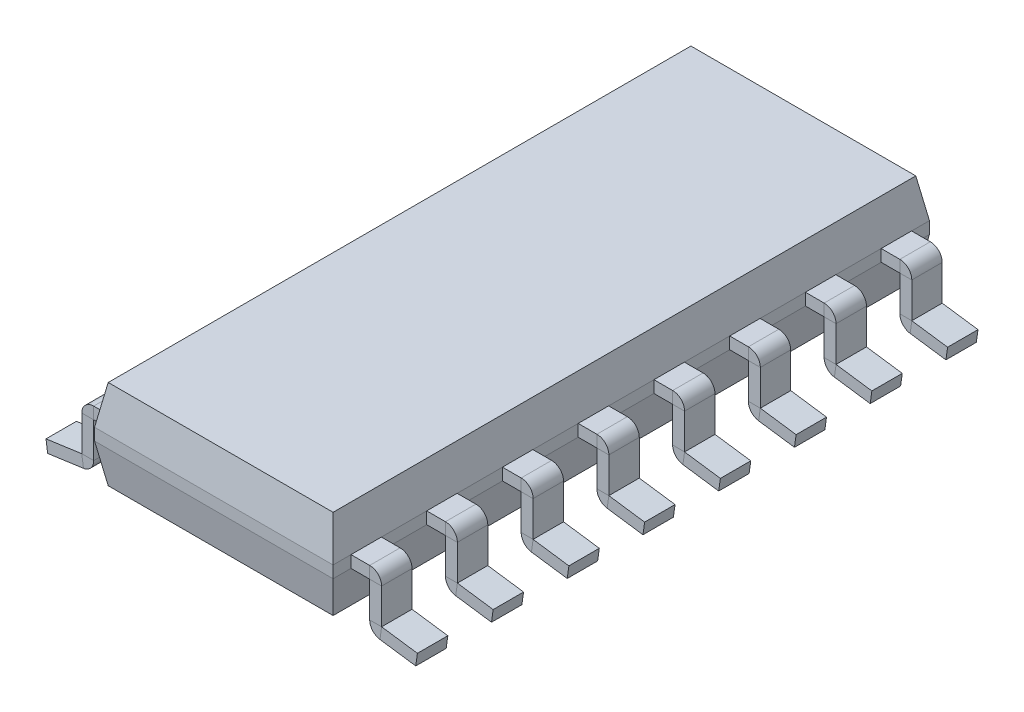
from build123d import *

# Parameters (mm, degrees)
CROQUIS6_W                   = 4
CROQUIS6_H                   = 1.5
SALIENTE_EXTRUIR3_DEPTH      = 5
CORTAR_EXTRUIR_L_MINA6_START = -10
CORTAR_EXTRUIR_L_MINA6_DEPTH = 10
CROQUIS11_W                  = 0.51
CROQUIS11_H                  = 0.2
MATRIZL1_COUNT               = 4
MATRIZL1_PITCH               = 1.27
SIMETR_A1_COPY_1_SKETCH_W    = 0.51
SIMETR_A1_COPY_1_SKETCH_H    = 0.2
SIMETR_A1_COPY_2_SKETCH_W    = 0.51
SIMETR_A1_COPY_2_SKETCH_H    = 0.2
SIMETR_A1_COPY_3_SKETCH_W    = 0.51
SIMETR_A1_COPY_3_SKETCH_H    = 0.2
SIMETR_A2_COPY_1_SKETCH_W    = 0.51
SIMETR_A2_COPY_1_SKETCH_H    = 0.2
SIMETR_A2_COPY_2_SKETCH_W    = 0.51
SIMETR_A2_COPY_2_SKETCH_H    = 0.2
SIMETR_A2_COPY_3_SKETCH_W    = 0.51
SIMETR_A2_COPY_3_SKETCH_H    = 0.2
SIMETR_A2_COPY_4_SKETCH_W    = 0.51
SIMETR_A2_COPY_4_SKETCH_H    = 0.2
SIMETR_A2_COPY_5_SKETCH_W    = 0.51
SIMETR_A2_COPY_5_SKETCH_H    = 0.2
SIMETR_A2_COPY_6_SKETCH_W    = 0.51
SIMETR_A2_COPY_6_SKETCH_H    = 0.2
SIMETR_A2_COPY_7_SKETCH_W    = 0.51
SIMETR_A2_COPY_7_SKETCH_H    = 0.2
CORTAR_EXTRUIR_L_MINA7_DEPTH = 2


# Read off the part's stored shape, not the designer's step: Cortar-Extruir-Lámina6
with BuildPart() as part:
    # Croquis6 → Saliente-Extruir3 (new, symmetric)
    with BuildSketch(Plane.XY):
        Rectangle(CROQUIS6_W, CROQUIS6_H)
    extrude(amount=SALIENTE_EXTRUIR3_DEPTH, both=True)

    # Cortar-Extruir-Lámina6 outline → Cortar-Extruir-Lámina6 (cut)
    with BuildSketch(Plane(origin=(0, 0, -5), x_dir=(-1, 0, 0), z_dir=(0, 0, -1)).offset(CORTAR_EXTRUIR_L_MINA6_START)):
        Polygon((-1.885387463, -0.75), (-2, -0.1), (-2, -0.75), align=None)
        Polygon((-2, 0.75), (-2, 0.1), (-1.885387463, 0.75), align=None)
        Polygon((2, -0.1), (1.885387463, -0.75), (2, -0.75), align=None)
        Polygon((2, 0.75), (1.885387463, 0.75), (2, 0.1), align=None)
    extrude(amount=CORTAR_EXTRUIR_L_MINA6_DEPTH, mode=Mode.SUBTRACT)

    # Barrer1: sweep along a path in Croquis10
    with BuildLine(Plane.XY.offset(0.635)) as barrer1_path:
        Line((2, 0), (2.31391731, 0))
        ThreePointArc((2.31391731, 0), (2.384627988, -0.029289322), (2.41391731, -0.1))
        Line((2.41391731, -0.1), (2.41391731, -0.691648692))
        ThreePointArc((2.41391731, -0.691648692), (2.438446352, -0.757254595), (2.5, -0.790675499))
        Line((2.5, -0.790675499), (3.1, -0.875))
    # Croquis11 → Barrer1 (sweep)
    with BuildSketch(Plane(origin=(3.1, -0.875, 0.635), x_dir=(0, 0, -1), z_dir=(0.9902680687415713, -0.13917310096005905, 0))):
        Rectangle(CROQUIS11_W, CROQUIS11_H)
    barrer1 = sweep(path=barrer1_path.line)

    # MatrizL1: Barrer1 ×4
    with Locations(*[(0, 0, i * MATRIZL1_PITCH) for i in range(1, MATRIZL1_COUNT)]):
        add(barrer1)

    # Simetría1: Barrer1 across plane
    add(barrer1.mirror(Plane(origin=(0, 0, 0), x_dir=(0, 0, 1), z_dir=(1, 0, 0))))

    # Simetría1 copy 1: sweep along a path in Simetría1 copy 1 path
    with BuildLine(Plane(origin=(0, 0, 1.905), x_dir=(-1, 0, 0), z_dir=(0, 0, 1))) as simetr_a1_copy_1_path:
        Line((2, 0), (2.31391731, 0))
        ThreePointArc((2.31391731, 0), (2.384627988, 0.029289322), (2.41391731, 0.1))
        Line((2.41391731, 0.1), (2.41391731, 0.691648692))
        ThreePointArc((2.41391731, 0.691648692), (2.438446352, 0.757254595), (2.5, 0.790675499))
        Line((2.5, 0.790675499), (3.1, 0.875))
    # Simetría1 copy 1 sketch → Simetría1 copy 1 (sweep)
    with BuildSketch(Plane(origin=(-3.1, -0.875, 1.905), x_dir=(0, 0, -1), z_dir=(-0.9902680687415713, -0.13917310096005905, 0))):
        Rectangle(SIMETR_A1_COPY_1_SKETCH_W, SIMETR_A1_COPY_1_SKETCH_H)
    sweep(path=simetr_a1_copy_1_path.line)

    # Simetría1 copy 2: sweep along a path in Simetría1 copy 2 path
    with BuildLine(Plane(origin=(0, 0, 3.175), x_dir=(-1, 0, 0), z_dir=(0, 0, 1))) as simetr_a1_copy_2_path:
        Line((2, 0), (2.31391731, 0))
        ThreePointArc((2.31391731, 0), (2.384627988, 0.029289322), (2.41391731, 0.1))
        Line((2.41391731, 0.1), (2.41391731, 0.691648692))
        ThreePointArc((2.41391731, 0.691648692), (2.438446352, 0.757254595), (2.5, 0.790675499))
        Line((2.5, 0.790675499), (3.1, 0.875))
    # Simetría1 copy 2 sketch → Simetría1 copy 2 (sweep)
    with BuildSketch(Plane(origin=(-3.1, -0.875, 3.175), x_dir=(0, 0, -1), z_dir=(-0.9902680687415713, -0.13917310096005905, 0))):
        Rectangle(SIMETR_A1_COPY_2_SKETCH_W, SIMETR_A1_COPY_2_SKETCH_H)
    sweep(path=simetr_a1_copy_2_path.line)

    # Simetría1 copy 3: sweep along a path in Simetría1 copy 3 path
    with BuildLine(Plane(origin=(0, 0, 4.445), x_dir=(-1, 0, 0), z_dir=(0, 0, 1))) as simetr_a1_copy_3_path:
        Line((2, 0), (2.31391731, 0))
        ThreePointArc((2.31391731, 0), (2.384627988, 0.029289322), (2.41391731, 0.1))
        Line((2.41391731, 0.1), (2.41391731, 0.691648692))
        ThreePointArc((2.41391731, 0.691648692), (2.438446352, 0.757254595), (2.5, 0.790675499))
        Line((2.5, 0.790675499), (3.1, 0.875))
    # Simetría1 copy 3 sketch → Simetría1 copy 3 (sweep)
    with BuildSketch(Plane(origin=(-3.1, -0.875, 4.445), x_dir=(0, 0, -1), z_dir=(-0.9902680687415713, -0.13917310096005905, 0))):
        Rectangle(SIMETR_A1_COPY_3_SKETCH_W, SIMETR_A1_COPY_3_SKETCH_H)
    sweep(path=simetr_a1_copy_3_path.line)

    # Simetría2: Barrer1 across plane
    add(barrer1.mirror(Plane.XY))

    # Simetría2 copy 1: sweep along a path in Simetría2 copy 1 path
    with BuildLine(Plane(origin=(0, 0, -1.905), x_dir=(1, 0, 0), z_dir=(0, 0, -1))) as simetr_a2_copy_1_path:
        Line((2, 0), (2.31391731, 0))
        ThreePointArc((2.31391731, 0), (2.384627988, 0.029289322), (2.41391731, 0.1))
        Line((2.41391731, 0.1), (2.41391731, 0.691648692))
        ThreePointArc((2.41391731, 0.691648692), (2.438446352, 0.757254595), (2.5, 0.790675499))
        Line((2.5, 0.790675499), (3.1, 0.875))
    # Simetría2 copy 1 sketch → Simetría2 copy 1 (sweep)
    with BuildSketch(Plane(origin=(3.1, -0.875, -1.905), x_dir=(0, 0, 1), z_dir=(0.9902680687415713, -0.13917310096005905, 0))):
        Rectangle(SIMETR_A2_COPY_1_SKETCH_W, SIMETR_A2_COPY_1_SKETCH_H)
    sweep(path=simetr_a2_copy_1_path.line)

    # Simetría2 copy 2: sweep along a path in Simetría2 copy 2 path
    with BuildLine(Plane(origin=(0, 0, -3.175), x_dir=(1, 0, 0), z_dir=(0, 0, -1))) as simetr_a2_copy_2_path:
        Line((2, 0), (2.31391731, 0))
        ThreePointArc((2.31391731, 0), (2.384627988, 0.029289322), (2.41391731, 0.1))
        Line((2.41391731, 0.1), (2.41391731, 0.691648692))
        ThreePointArc((2.41391731, 0.691648692), (2.438446352, 0.757254595), (2.5, 0.790675499))
        Line((2.5, 0.790675499), (3.1, 0.875))
    # Simetría2 copy 2 sketch → Simetría2 copy 2 (sweep)
    with BuildSketch(Plane(origin=(3.1, -0.875, -3.175), x_dir=(0, 0, 1), z_dir=(0.9902680687415713, -0.13917310096005905, 0))):
        Rectangle(SIMETR_A2_COPY_2_SKETCH_W, SIMETR_A2_COPY_2_SKETCH_H)
    sweep(path=simetr_a2_copy_2_path.line)

    # Simetría2 copy 3: sweep along a path in Simetría2 copy 3 path
    with BuildLine(Plane(origin=(0, 0, -4.445), x_dir=(1, 0, 0), z_dir=(0, 0, -1))) as simetr_a2_copy_3_path:
        Line((2, 0), (2.31391731, 0))
        ThreePointArc((2.31391731, 0), (2.384627988, 0.029289322), (2.41391731, 0.1))
        Line((2.41391731, 0.1), (2.41391731, 0.691648692))
        ThreePointArc((2.41391731, 0.691648692), (2.438446352, 0.757254595), (2.5, 0.790675499))
        Line((2.5, 0.790675499), (3.1, 0.875))
    # Simetría2 copy 3 sketch → Simetría2 copy 3 (sweep)
    with BuildSketch(Plane(origin=(3.1, -0.875, -4.445), x_dir=(0, 0, 1), z_dir=(0.9902680687415713, -0.13917310096005905, 0))):
        Rectangle(SIMETR_A2_COPY_3_SKETCH_W, SIMETR_A2_COPY_3_SKETCH_H)
    sweep(path=simetr_a2_copy_3_path.line)

    # Simetría2 copy 4: sweep along a path in Simetría2 copy 4 path
    with BuildLine(Plane(origin=(0, 0, -0.635), x_dir=(-1, 0, 0), z_dir=(0, 0, -1))) as simetr_a2_copy_4_path:
        Line((2, 0), (2.31391731, 0))
        ThreePointArc((2.31391731, 0), (2.384627988, -0.029289322), (2.41391731, -0.1))
        Line((2.41391731, -0.1), (2.41391731, -0.691648692))
        ThreePointArc((2.41391731, -0.691648692), (2.438446352, -0.757254595), (2.5, -0.790675499))
        Line((2.5, -0.790675499), (3.1, -0.875))
    # Simetría2 copy 4 sketch → Simetría2 copy 4 (sweep)
    with BuildSketch(Plane(origin=(-3.1, -0.875, -0.635), x_dir=(0, 0, 1), z_dir=(-0.9902680687415713, -0.13917310096005905, 0))):
        Rectangle(SIMETR_A2_COPY_4_SKETCH_W, SIMETR_A2_COPY_4_SKETCH_H)
    sweep(path=simetr_a2_copy_4_path.line)

    # Simetría2 copy 5: sweep along a path in Simetría2 copy 5 path
    with BuildLine(Plane(origin=(0, 0, -1.905), x_dir=(-1, 0, 0), z_dir=(0, 0, -1))) as simetr_a2_copy_5_path:
        Line((2, 0), (2.31391731, 0))
        ThreePointArc((2.31391731, 0), (2.384627988, -0.029289322), (2.41391731, -0.1))
        Line((2.41391731, -0.1), (2.41391731, -0.691648692))
        ThreePointArc((2.41391731, -0.691648692), (2.438446352, -0.757254595), (2.5, -0.790675499))
        Line((2.5, -0.790675499), (3.1, -0.875))
    # Simetría2 copy 5 sketch → Simetría2 copy 5 (sweep)
    with BuildSketch(Plane(origin=(-3.1, -0.875, -1.905), x_dir=(0, 0, 1), z_dir=(-0.9902680687415713, -0.13917310096005905, 0))):
        Rectangle(SIMETR_A2_COPY_5_SKETCH_W, SIMETR_A2_COPY_5_SKETCH_H)
    sweep(path=simetr_a2_copy_5_path.line)

    # Simetría2 copy 6: sweep along a path in Simetría2 copy 6 path
    with BuildLine(Plane(origin=(0, 0, -3.175), x_dir=(-1, 0, 0), z_dir=(0, 0, -1))) as simetr_a2_copy_6_path:
        Line((2, 0), (2.31391731, 0))
        ThreePointArc((2.31391731, 0), (2.384627988, -0.029289322), (2.41391731, -0.1))
        Line((2.41391731, -0.1), (2.41391731, -0.691648692))
        ThreePointArc((2.41391731, -0.691648692), (2.438446352, -0.757254595), (2.5, -0.790675499))
        Line((2.5, -0.790675499), (3.1, -0.875))
    # Simetría2 copy 6 sketch → Simetría2 copy 6 (sweep)
    with BuildSketch(Plane(origin=(-3.1, -0.875, -3.175), x_dir=(0, 0, 1), z_dir=(-0.9902680687415713, -0.13917310096005905, 0))):
        Rectangle(SIMETR_A2_COPY_6_SKETCH_W, SIMETR_A2_COPY_6_SKETCH_H)
    sweep(path=simetr_a2_copy_6_path.line)

    # Simetría2 copy 7: sweep along a path in Simetría2 copy 7 path
    with BuildLine(Plane(origin=(0, 0, -4.445), x_dir=(-1, 0, 0), z_dir=(0, 0, -1))) as simetr_a2_copy_7_path:
        Line((2, 0), (2.31391731, 0))
        ThreePointArc((2.31391731, 0), (2.384627988, -0.029289322), (2.41391731, -0.1))
        Line((2.41391731, -0.1), (2.41391731, -0.691648692))
        ThreePointArc((2.41391731, -0.691648692), (2.438446352, -0.757254595), (2.5, -0.790675499))
        Line((2.5, -0.790675499), (3.1, -0.875))
    # Simetría2 copy 7 sketch → Simetría2 copy 7 (sweep)
    with BuildSketch(Plane(origin=(-3.1, -0.875, -4.445), x_dir=(0, 0, 1), z_dir=(-0.9902680687415713, -0.13917310096005905, 0))):
        Rectangle(SIMETR_A2_COPY_7_SKETCH_W, SIMETR_A2_COPY_7_SKETCH_H)
    sweep(path=simetr_a2_copy_7_path.line)

    # Croquis13 → Cortar-Extruir-Lámina7 (cut, symmetric)
    with BuildSketch(Plane(origin=(0, 0, 0), x_dir=(0, 0, -1), z_dir=(1, 0, 0))):
        Polygon((-4.885387463, -0.75), (-5, -0.1), (-5, 0.1), (-4.885387463, 0.75), (-14.733464993, 2.486481777), (-15, 0.974886635), (-15, -0.974886635), (-14.733464993, -2.486481777), align=None)
        Polygon((4.885387463, 0.75), (5, 0.1), (5, -0.1), (4.885387463, -0.75), (14.733464993, -2.486481777), (15, -0.974886635), (15, 0.974886635), (14.733464993, 2.486481777), align=None)
    extrude(amount=CORTAR_EXTRUIR_L_MINA7_DEPTH, both=True, mode=Mode.SUBTRACT)


solid = part.part
